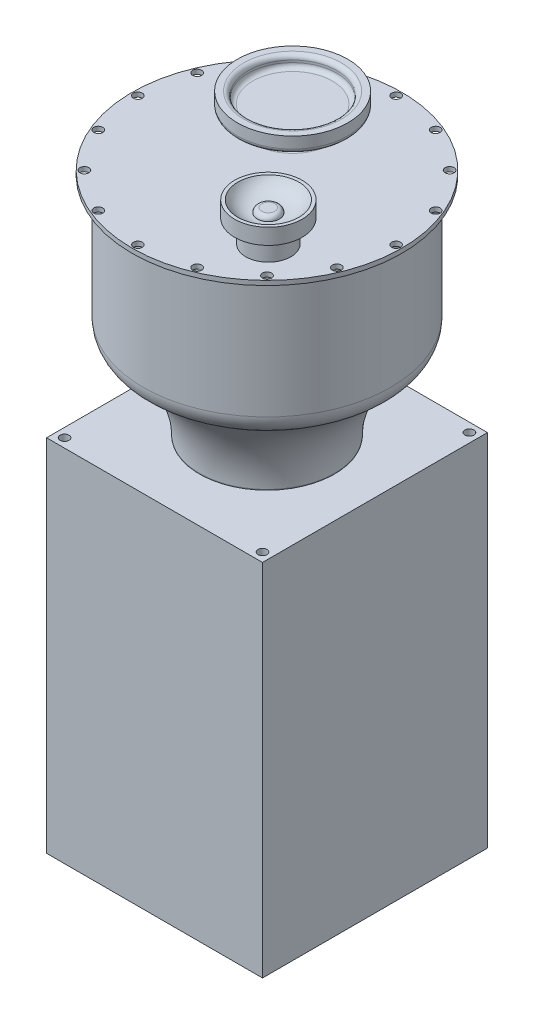
from build123d import *

# Parameters (mm, degrees)
SKETCH1_W           = 121.92
SKETCH1_H           = 127
BOSS_EXTRUDE1_DEPTH = 203.2
SKETCH2_R           = 38.1
BOSS_EXTRUDE2_DEPTH = 50.8
SKETCH3_R           = 69.85
BOSS_EXTRUDE3_DEPTH = 76.2
FILLET1_R           = 55.88
FILLET2_R           = 12.7
SKETCH4_R           = 63.5
CUT_EXTRUDE1_DEPTH  = 76.2
CUT_EXTRUDE1_DRAFT  = -9
FILLET3_R           = 12.7
SKETCH5_R           = 76.2
BOSS_EXTRUDE4_DEPTH = 2.54
SKETCH6_R           = 2.54
CUT_EXTRUDE2_DEPTH  = 2.54
SKETCH8_R           = 12.7
BOSS_EXTRUDE5_DEPTH = 12.7
SKETCH9_R           = 19.05
BOSS_EXTRUDE6_DEPTH = 8.89
SKETCH10_R          = 17.227790741
CUT_EXTRUDE9_DEPTH  = 6.35
FILLET4_R           = 12.7
SKETCH11_R          = 6.229268113
BOSS_EXTRUDE7_DEPTH = 2.54
FILLET5_R           = 2.54
SKETCH12_R          = 19.05
BOSS_EXTRUDE8_DEPTH = 6.35
SKETCH13_R          = 31.164308849
BOSS_EXTRUDE9_DEPTH = 8.89
SKETCH14_R          = 25.036883069
CUT_EXTRUDE11_DEPTH = 6.35
FILLET6_R           = 2.54
FILLET7_R           = 2.54
FILLET8_R           = 2.54
FILLET9_R           = 2.54
FILLET10_R          = 2.54
CUT_EXTRUDE12_DEPTH = 203.2


# Some blends are built 0.0001 mm under size
with BuildPart() as part:
    # Sketch1 → Boss-Extrude1 (new body)
    with BuildSketch(Plane(origin=(0, 0, 0), x_dir=(1, 0, 0), z_dir=(0, 1, 0))):
        Rectangle(SKETCH1_W, SKETCH1_H)
    extrude(amount=BOSS_EXTRUDE1_DEPTH)

    # Sketch2 → Boss-Extrude2 (add)
    with BuildSketch(Plane(origin=(0, 203.2, 0), x_dir=(1, 0, 0), z_dir=(0, 1, 0))):
        with Locations(Location((0, 0, 0), (0, 0, 90))):
            Circle(SKETCH2_R)
    extrude(amount=BOSS_EXTRUDE2_DEPTH)

    # Sketch3 → Boss-Extrude3 (add)
    with BuildSketch(Plane(origin=(0, 254, 0), x_dir=(1, 0, 0), z_dir=(0, 1, 0))):
        with Locations(Location((0, 0, 0), (0, 0, 90))):
            Circle(SKETCH3_R)
    extrude(amount=BOSS_EXTRUDE3_DEPTH)

    # Fillet1
    # the kernel refuses this fillet: 55.88 mm, written as the material it adds along each edge
    with BuildSketch(Plane(origin=(0, 254, 0), x_dir=(0, 0, -1), z_dir=(1, 0, 0))) as fillet1_piece_1:
        with BuildLine():
            CenterArc((93.98, -50.401562476), FILLET1_R, 115.583001977, 64.416998023)
            Line((38.1, -50.401562476), (36.9824, -50.401562476))
            Line((36.9824, -50.401562476), (36.9824, 0))
            Line((36.9824, 0), (38.1, 1.1176))
            ThreePointArc((38.1, 1.1176), (53.975, 1.1176), (69.3674, 1.00803125))
            Line((69.3674, 1.00803125), (69.85, 0))
        make_face()
    revolve(axis=Axis((0, 254, 0), (0, 1, 0)))

    # Fillet2
    fillet2_edges = [part.edges().sort_by_distance(p)[0] for p in [
        (0, 254, 69.85),
    ]]
    fillet(fillet2_edges, radius=FILLET2_R)


with BuildPart() as cut_extrude1_tool:
    # Sketch4 → Cut-Extrude1 (with draft: the straight prism first)
    with BuildSketch(Plane(origin=(0, 330.2, 0), x_dir=(1, 0, 0), z_dir=(0, 1, 0))):
        Circle(SKETCH4_R)
    extrude(amount=-CUT_EXTRUDE1_DEPTH)
    # Cut-Extrude1: the draft: its side faces are tilted about the plane it starts from
    cut_extrude1_sides = [cut_extrude1_tool.faces().sort_by_distance(p)[0] for p in [
        (-63.5, 292.1, 0),
    ]]
    draft(cut_extrude1_sides, Plane(origin=(0, 330.2, 0), x_dir=(1, 0, 0), z_dir=(0, 1, 0)), CUT_EXTRUDE1_DRAFT)


with BuildPart() as part_1:
    add(part.part)

    # Cut-Extrude1: cut by cut_extrude1_tool
    add(cut_extrude1_tool.part, mode=Mode.SUBTRACT)

    # Fillet3
    fillet3_edges = [part_1.edges().sort_by_distance(p)[0] for p in [
        (-51.431105647, 254, 0),
    ]]
    fillet(fillet3_edges, radius=FILLET3_R)

    # Sketch5 → Boss-Extrude4 (add)
    with BuildSketch(Plane(origin=(0, 330.2, 0), x_dir=(1, 0, 0), z_dir=(0, 1, 0))):
        with Locations(Location((0, 0, 0), (0, 0, 270))):
            Circle(SKETCH5_R)
    extrude(amount=BOSS_EXTRUDE4_DEPTH)

    # Sketch6 → Cut-Extrude2 (cut)
    with BuildSketch(Plane(origin=(0, 332.74, 0), x_dir=(1, 0, 0), z_dir=(0, 1, 0))):
        with Locations(Location((0, 72.898, 0), (0, 0, 270))):
            Circle(SKETCH6_R)
        with Locations(Location((27.896856853, 67.348970161, 0), (0, 0, 270))):
            Circle(SKETCH6_R)
        with Locations(Location((51.546670135, 51.546670135, 0), (0, 0, 270))):
            Circle(SKETCH6_R)
        with Locations(Location((67.348970161, 27.896856853, 0), (0, 0, 270))):
            Circle(SKETCH6_R)
        with Locations(Location((72.898, 0, 0), (0, 0, 270))):
            Circle(SKETCH6_R)
        with Locations(Location((67.348970161, -27.896856853, 0), (0, 0, 270))):
            Circle(SKETCH6_R)
        with Locations(Location((51.546670135, -51.546670135, 0), (0, 0, 270))):
            Circle(SKETCH6_R)
        with Locations(Location((27.896856853, -67.348970161, 0), (0, 0, 270))):
            Circle(SKETCH6_R)
        with Locations(Location((0, -72.898, 0), (0, 0, 270))):
            Circle(SKETCH6_R)
        with Locations(Location((-27.896856853, -67.348970161, 0), (0, 0, 270))):
            Circle(SKETCH6_R)
        with Locations(Location((-51.546670135, -51.546670135, 0), (0, 0, 270))):
            Circle(SKETCH6_R)
        with Locations(Location((-67.348970161, -27.896856853, 0), (0, 0, 270))):
            Circle(SKETCH6_R)
        with Locations(Location((-72.898, 0, 0), (0, 0, 270))):
            Circle(SKETCH6_R)
        with Locations(Location((-67.348970161, 27.896856853, 0), (0, 0, 270))):
            Circle(SKETCH6_R)
        with Locations(Location((-51.546670135, 51.546670135, 0), (0, 0, 270))):
            Circle(SKETCH6_R)
        with Locations(Location((-27.896856853, 67.348970161, 0), (0, 0, 270))):
            Circle(SKETCH6_R)
    extrude(amount=-CUT_EXTRUDE2_DEPTH, mode=Mode.SUBTRACT)

    # Sketch8 → Boss-Extrude5 (add)
    with BuildSketch(Plane(origin=(0, 332.74, 0), x_dir=(1, 0, 0), z_dir=(0, 1, 0))):
        with Locations(Location((36.393819719, -35.619483129, 0), (0, 0, 270))):
            Circle(SKETCH8_R)
    extrude(amount=BOSS_EXTRUDE5_DEPTH)

    # Sketch9 → Boss-Extrude6 (add)
    with BuildSketch(Plane(origin=(0, 345.44, 0), x_dir=(1, 0, 0), z_dir=(0, 1, 0))):
        with Locations(Location((36.393819719, -35.619483129, 0), (0, 0, 270))):
            Circle(SKETCH9_R)
    extrude(amount=BOSS_EXTRUDE6_DEPTH)

    # Sketch10 → Cut-Extrude9 (cut)
    with BuildSketch(Plane(origin=(0, 354.33, 0), x_dir=(1, 0, 0), z_dir=(0, 1, 0))):
        with Locations(Location((36.393819719, -35.619483129, 0), (0, 0, 270))):
            Circle(SKETCH10_R)
    extrude(amount=-CUT_EXTRUDE9_DEPTH, mode=Mode.SUBTRACT)

    # Fillet4
    # the kernel refuses this fillet: 12.7 mm, written as the material it adds along each edge
    with BuildSketch(Plane(origin=(36.393819719, 347.98, 35.619483129), x_dir=(0, 0, 1), z_dir=(-1, 0, 0))) as fillet4_piece_1:
        with BuildLine():
            CenterArc((6.229268113, 12.7), FILLET4_R, 270, 60)
            Line((6.229268113, 0), (6.229268113, -0.254))
            Line((6.229268113, -0.254), (17.227790741, -0.254))
            Line((17.227790741, -0.254), (17.481790741, 0))
            ThreePointArc((17.481790741, 0), (17.481790741, 3.175), (17.447761194, 6.223))
            Line((17.447761194, 6.223), (17.227790741, 6.35))
        make_face()
    revolve(axis=Axis((36.393819719, 347.98, 35.619483129), (0, 1, 0)))

    # Sketch11 → Boss-Extrude7 (add)
    with BuildSketch(Plane(origin=(0, 347.98, 0), x_dir=(1, 0, 0), z_dir=(0, 1, 0))):
        with Locations(Location((36.393819719, -35.619483129, 0), (0, 0, 270))):
            Circle(SKETCH11_R)
    extrude(amount=BOSS_EXTRUDE7_DEPTH)

    # Fillet5
    fillet5_edges = [part_1.edges().sort_by_distance(p)[0] for p in [
        (36.393819719, 350.52, 29.390215016),
    ]]
    fillet(fillet5_edges, radius=FILLET5_R - 0.0001)  # a hair under: the kernel refuses the full size

    # Sketch12 → Boss-Extrude8 (add)
    with BuildSketch(Plane(origin=(0, 332.74, 0), x_dir=(1, 0, 0), z_dir=(0, 1, 0))):
        with Locations(Location((-16.261068385, 30.715351394, 0), (0, 0, 270))):
            Circle(SKETCH12_R)
    extrude(amount=BOSS_EXTRUDE8_DEPTH)

    # Sketch13 → Boss-Extrude9 (add)
    with BuildSketch(Plane(origin=(0, 339.09, 0), x_dir=(1, 0, 0), z_dir=(0, 1, 0))):
        with Locations(Location((-16.261068385, 30.715351394, 0), (0, 0, 90))):
            Circle(SKETCH13_R)
    extrude(amount=BOSS_EXTRUDE9_DEPTH)

    # Sketch14 → Cut-Extrude11 (cut)
    with BuildSketch(Plane(origin=(0, 347.98, 0), x_dir=(1, 0, 0), z_dir=(0, 1, 0))):
        with Locations(Location((-16.261068385, 30.715351394, 0), (0, 0, 270))):
            Circle(SKETCH14_R)
    extrude(amount=-CUT_EXTRUDE11_DEPTH, mode=Mode.SUBTRACT)

    # Fillet6
    fillet6_edges = [part_1.edges().sort_by_distance(p)[0] for p in [
        (-16.261068385, 341.63, -55.752234463),
    ]]
    fillet(fillet6_edges, radius=FILLET6_R)

    # Fillet7
    fillet7_edges = [part_1.edges().sort_by_distance(p)[0] for p in [
        (-16.261068385, 347.98, -55.752234463),
    ]]
    fillet(fillet7_edges, radius=FILLET7_R)

    # Fillet8
    fillet8_edges = [part_1.edges().sort_by_distance(p)[0] for p in [
        (-16.261068385, 332.74, -49.765351394),
    ]]
    fillet(fillet8_edges, radius=FILLET8_R)

    # Fillet9
    fillet9_edges = [part_1.edges().sort_by_distance(p)[0] for p in [
        (-16.261068385, 339.09, -49.765351394),
    ]]
    fillet(fillet9_edges, radius=FILLET9_R)

    # Fillet10
    fillet10_edges = [part_1.edges().sort_by_distance(p)[0] for p in [
        (-16.261068385, 339.09, 0.448957456),
    ]]
    fillet(fillet10_edges, radius=FILLET10_R)

    # Sketch15 → Cut-Extrude12 (cut)
    with BuildSketch(Plane.XZ):
        with BuildLine():
            ThreePointArc((53.34, 58.42), (54.083948776, 56.623948776), (55.88, 55.88))
            Line((55.88, 55.88), (55.88, 58.42))
            Line((55.88, 58.42), (53.34, 58.42))
        make_face()
        with BuildLine():
            Line((55.88, 58.42), (55.88, 55.88))
            ThreePointArc((55.88, 55.88), (57.676051224, 56.623948776), (58.42, 58.42))
            ThreePointArc((58.42, 58.42), (55.88, 60.96), (53.34, 58.42))
            Line((53.34, 58.42), (55.88, 58.42))
        make_face()
        with BuildLine():
            ThreePointArc((53.34, 58.42), (54.083948776, 56.623948776), (55.88, 55.88))
            Line((55.88, 55.88), (55.88, 58.42))
            Line((55.88, 58.42), (53.34, 58.42))
        make_face()
        with BuildLine():
            Line((55.88, 58.42), (55.88, 55.88))
            ThreePointArc((55.88, 55.88), (57.676051224, 56.623948776), (58.42, 58.42))
            ThreePointArc((58.42, 58.42), (55.88, 60.96), (53.34, 58.42))
            Line((53.34, 58.42), (55.88, 58.42))
        make_face()
        with BuildLine():
            ThreePointArc((-55.88, 55.88), (-54.083948776, 56.623948776), (-53.34, 58.42))
            Line((-53.34, 58.42), (-55.88, 58.42))
            Line((-55.88, 58.42), (-55.88, 55.88))
        make_face()
        with BuildLine():
            Line((-55.88, 58.42), (-53.34, 58.42))
            ThreePointArc((-53.34, 58.42), (-57.676051224, 60.216051224), (-55.88, 55.88))
            Line((-55.88, 55.88), (-55.88, 58.42))
        make_face()
        with BuildLine():
            ThreePointArc((-55.88, 55.88), (-54.083948776, 56.623948776), (-53.34, 58.42))
            Line((-53.34, 58.42), (-55.88, 58.42))
            Line((-55.88, 58.42), (-55.88, 55.88))
        make_face()
        with BuildLine():
            Line((-55.88, 58.42), (-53.34, 58.42))
            ThreePointArc((-53.34, 58.42), (-57.676051224, 60.216051224), (-55.88, 55.88))
            Line((-55.88, 55.88), (-55.88, 58.42))
        make_face()
        with BuildLine():
            ThreePointArc((-55.88, -55.88), (-57.676051224, -60.216051224), (-53.34, -58.42))
            Line((-53.34, -58.42), (-55.88, -58.42))
            Line((-55.88, -58.42), (-55.88, -55.88))
        make_face()
        with BuildLine():
            Line((-55.88, -58.42), (-53.34, -58.42))
            ThreePointArc((-53.34, -58.42), (-54.083948776, -56.623948776), (-55.88, -55.88))
            Line((-55.88, -55.88), (-55.88, -58.42))
        make_face()
        with BuildLine():
            ThreePointArc((-55.88, -55.88), (-57.676051224, -60.216051224), (-53.34, -58.42))
            Line((-53.34, -58.42), (-55.88, -58.42))
            Line((-55.88, -58.42), (-55.88, -55.88))
        make_face()
        with BuildLine():
            Line((-55.88, -58.42), (-53.34, -58.42))
            ThreePointArc((-53.34, -58.42), (-54.083948776, -56.623948776), (-55.88, -55.88))
            Line((-55.88, -55.88), (-55.88, -58.42))
        make_face()
        with BuildLine():
            Line((53.34, -58.42), (55.88, -58.42))
            Line((55.88, -58.42), (55.88, -55.88))
            ThreePointArc((55.88, -55.88), (54.083948776, -56.623948776), (53.34, -58.42))
        make_face()
        with BuildLine():
            Line((55.88, -55.88), (55.88, -58.42))
            Line((55.88, -58.42), (53.34, -58.42))
            ThreePointArc((53.34, -58.42), (55.88, -60.96), (58.42, -58.42))
            ThreePointArc((58.42, -58.42), (57.676051224, -56.623948776), (55.88, -55.88))
        make_face()
        with BuildLine():
            Line((53.34, -58.42), (55.88, -58.42))
            Line((55.88, -58.42), (55.88, -55.88))
            ThreePointArc((55.88, -55.88), (54.083948776, -56.623948776), (53.34, -58.42))
        make_face()
        with BuildLine():
            Line((55.88, -55.88), (55.88, -58.42))
            Line((55.88, -58.42), (53.34, -58.42))
            ThreePointArc((53.34, -58.42), (55.88, -60.96), (58.42, -58.42))
            ThreePointArc((58.42, -58.42), (57.676051224, -56.623948776), (55.88, -55.88))
        make_face()
    extrude(amount=-CUT_EXTRUDE12_DEPTH, mode=Mode.SUBTRACT)


solid = part_1.part
